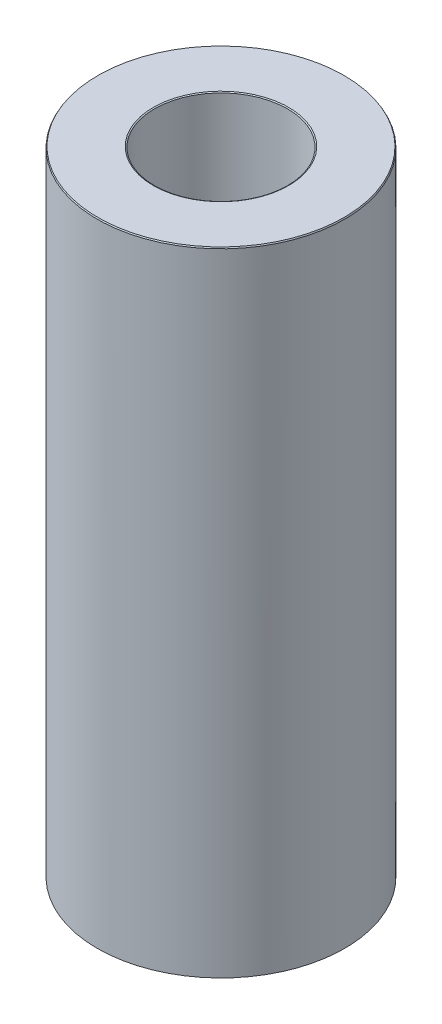
from build123d import *
from OCP.BRepFilletAPI import BRepFilletAPI_MakeChamfer

# Parameters (mm, degrees)
SKETCH1_R           = 50
BOSS_EXTRUDE1_DEPTH = 255.949453429
SKETCH2_R           = 26.893710722
CUT_EXTRUDE1_DEPTH  = 266.537422429
CHAMFER1_SIZE       = 0.472396573
CHAMFER1_SIZE2      = 0.272738289


with BuildPart() as part:
    # Sketch1 → Boss-Extrude1 (new body)
    with BuildSketch(Plane(origin=(0, 0, 0), x_dir=(1, 0, 0), z_dir=(0, 1, 0))):
        Circle(SKETCH1_R)
    extrude(amount=BOSS_EXTRUDE1_DEPTH)

    # Sketch2 → Cut-Extrude1 (cut, through all)
    with BuildSketch(Plane(origin=(0, 0, 0), x_dir=(1, 0, 0), z_dir=(0, 1, 0))):
        Circle(SKETCH2_R)
    extrude(amount=CUT_EXTRUDE1_DEPTH, mode=Mode.SUBTRACT)

    # Chamfer1: one chamfer whose edges measure the first distance from different faces: ONE call of the kernel's chamfer builder (chamfer() names one face for all edges)
    chamfer1_edges_1 = [part.edges().sort_by_distance(p)[0] for p in [
        (-26.893710722, 255.949453429, 0),
    ]]
    chamfer1_side_1 = [part.faces().sort_by_distance(p)[0] for p in [
        (-48.585786438, 255.949453429, 0),
    ]]
    chamfer1_edges_2 = [part.edges().sort_by_distance(p)[0] for p in [
        (-26.893710722, 0, 0),
    ]]
    chamfer1_side_2 = [part.faces().sort_by_distance(p)[0] for p in [
        (-26.893710722, 127.974726714, 0),
    ]]
    chamfer1_edges_3 = [part.edges().sort_by_distance(p)[0] for p in [
        (-50, 0, 0),
    ]]
    chamfer1_side_3 = [part.faces().sort_by_distance(p)[0] for p in [
        (-48.585786438, 0, 0),
    ]]
    chamfer1_edges_4 = [part.edges().sort_by_distance(p)[0] for p in [
        (-50, 255.949453429, 0),
    ]]
    chamfer1_side_4 = [part.faces().sort_by_distance(p)[0] for p in [
        (-50, 127.974726714, 0),
    ]]
    chamfer1 = BRepFilletAPI_MakeChamfer(part.part.solid().wrapped)
    for e in chamfer1_edges_1:
        chamfer1.Add(CHAMFER1_SIZE, CHAMFER1_SIZE2, e.wrapped, chamfer1_side_1[0].wrapped)  # the first distance lies on this face
    for e in chamfer1_edges_2:
        chamfer1.Add(CHAMFER1_SIZE, CHAMFER1_SIZE2, e.wrapped, chamfer1_side_2[0].wrapped)  # the first distance lies on this face
    for e in chamfer1_edges_3:
        chamfer1.Add(CHAMFER1_SIZE, CHAMFER1_SIZE2, e.wrapped, chamfer1_side_3[0].wrapped)  # the first distance lies on this face
    for e in chamfer1_edges_4:
        chamfer1.Add(CHAMFER1_SIZE, CHAMFER1_SIZE2, e.wrapped, chamfer1_side_4[0].wrapped)  # the first distance lies on this face
    add(Compound.cast(chamfer1.Shape()), mode=Mode.REPLACE)


solid = part.part
